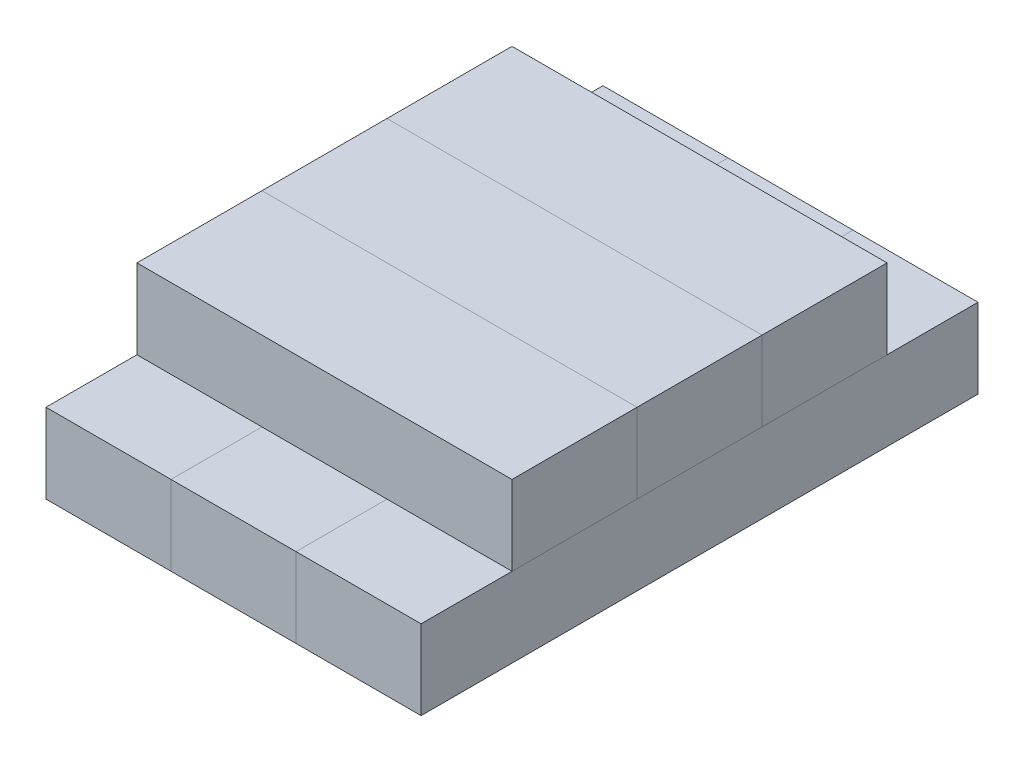
from build123d import *

# Parameters (mm, degrees)
SKETCH1_W             = 139.7
SKETCH1_H             = 88.9
BOSS_EXTRUDE1_DEPTH   = 622.3
BOSS_EXTRUDE1_2_DEPTH = 622.3
SKETCH1_4_W           = 139.7
SKETCH1_4_H           = 88.9
BOSS_EXTRUDE2_DEPTH   = 622.3
SKETCH2_W             = 139.7
SKETCH2_H             = 88.9
BOSS_EXTRUDE3_DEPTH   = 419.1
LPATTERN1_OUTLINE_W   = 88.9
LPATTERN1_OUTLINE_H   = 139.7
LPATTERN1_DEPTH       = 419.1
LPATTERN1_2_OUTLINE_W = 88.9
LPATTERN1_2_OUTLINE_H = 139.7
LPATTERN1_2_DEPTH     = 419.1


# Read off the part's stored shape, not the designer's step: LPattern1
with BuildPart() as part:
    # Sketch1 → Boss-Extrude1 (new body)
    with BuildSketch(Plane.XY):
        with Locations((69.85, 44.45)):
            Rectangle(SKETCH1_W, SKETCH1_H)
    extrude(amount=BOSS_EXTRUDE1_DEPTH)


with BuildPart() as body_2:
    # Sketch1 → Boss-Extrude1 2 (new body)
    with BuildSketch(Plane.XY):
        with Locations((349.25, 44.45)):
            Rectangle(SKETCH1_W, SKETCH1_H)
    extrude(amount=BOSS_EXTRUDE1_2_DEPTH)


with BuildPart() as body_3:
    # Sketch1<4> → Boss-Extrude2 (new body)
    with BuildSketch(Plane.XY):
        with Locations((209.55, 44.45)):
            Rectangle(SKETCH1_4_W, SKETCH1_4_H)
    extrude(amount=BOSS_EXTRUDE2_DEPTH)


with BuildPart() as body_4:
    # Sketch2 → Boss-Extrude3 (new body)
    with BuildSketch(Plane(origin=(0, 0, 0), x_dir=(0, 0, -1), z_dir=(1, 0, 0))):
        with Locations((-450.85, 133.35)):
            Rectangle(SKETCH2_W, SKETCH2_H)
    extrude(amount=BOSS_EXTRUDE3_DEPTH)


with BuildPart() as body_5:
    # LPattern1 outline → LPattern1 (new body)
    with BuildSketch(Plane.YZ):
        with Locations((133.35, 171.45)):
            Rectangle(LPATTERN1_OUTLINE_W, LPATTERN1_OUTLINE_H)
    extrude(amount=LPATTERN1_DEPTH)


with BuildPart() as body_6:
    # LPattern1 2 outline → LPattern1 2 (new body)
    with BuildSketch(Plane.YZ):
        with Locations((133.35, 311.15)):
            Rectangle(LPATTERN1_2_OUTLINE_W, LPATTERN1_2_OUTLINE_H)
    extrude(amount=LPATTERN1_2_DEPTH)


solid = Compound([part.part, body_2.part, body_3.part, body_4.part, body_5.part, body_6.part])
